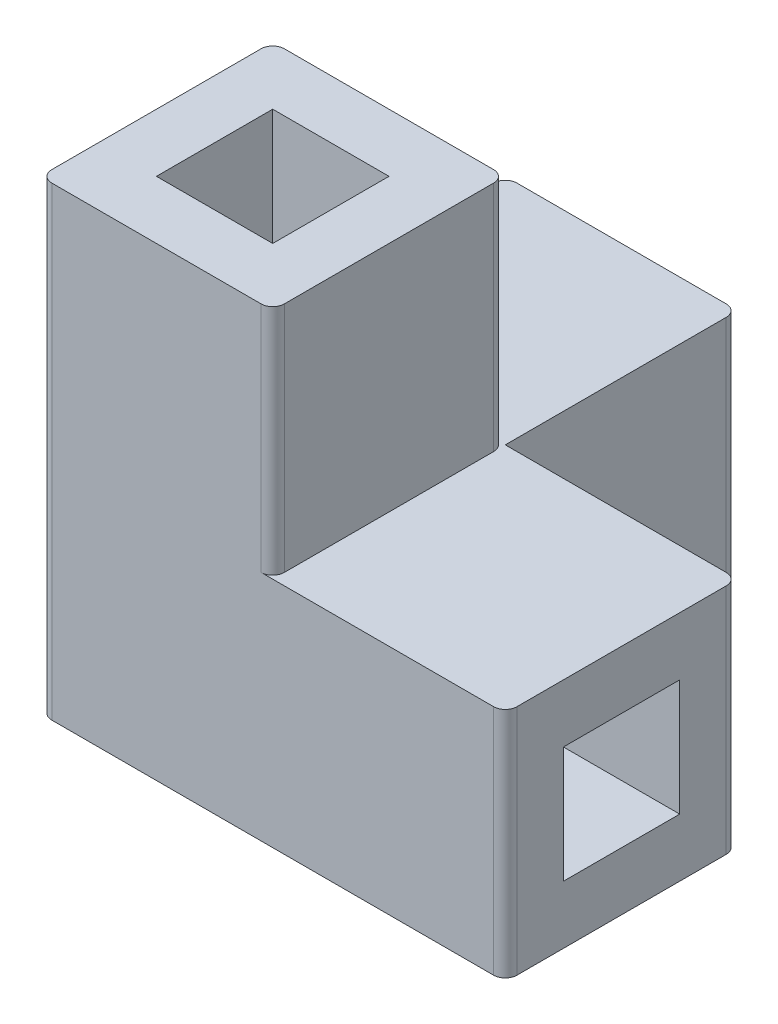
from build123d import *

# Parameters (mm, degrees)
SALIENTE_EXTRUIR1_DEPTH = 80
CROQUIS2_W              = 40
CROQUIS2_H              = 40
CORTAR_EXTRUIR1_DEPTH   = 80
CROQUIS3_W              = 40
CROQUIS3_H              = 40
CORTAR_EXTRUIR2_DEPTH   = 80
REDONDEO1_R             = 2
CROQUIS4_W              = 20
CROQUIS4_H              = 20
CORTAR_EXTRUIR3_DEPTH   = 80
CROQUIS5_W              = 20
CROQUIS5_H              = 20
CORTAR_EXTRUIR4_DEPTH   = 50
CROQUIS6_W              = 20
CROQUIS6_H              = 20
CORTAR_EXTRUIR5_DEPTH   = 50


with BuildPart() as part:
    # Croquis1 → Saliente-Extruir1 (new body)
    with BuildSketch(Plane(origin=(0, 0, 0), x_dir=(1, 0, 0), z_dir=(0, 1, 0))):
        Polygon((0, 80), (0, 0), (80, 0), (80, 40), (40, 40), (40, 80), align=None)
    extrude(amount=SALIENTE_EXTRUIR1_DEPTH)

    # Croquis2 → Cortar-Extruir1 (cut)
    with BuildSketch(Plane.XY):
        with Locations((60, 60)):
            Rectangle(CROQUIS2_W, CROQUIS2_H)
    extrude(amount=-CORTAR_EXTRUIR1_DEPTH, mode=Mode.SUBTRACT)

    # Croquis3 → Cortar-Extruir2 (cut)
    with BuildSketch(Plane(origin=(40, 0, 0), x_dir=(0, 0, -1), z_dir=(1, 0, 0))):
        with Locations((60, 60)):
            Rectangle(CROQUIS3_W, CROQUIS3_H)
    extrude(amount=-CORTAR_EXTRUIR2_DEPTH, mode=Mode.SUBTRACT)

    # Redondeo1
    # the kernel refuses this fillet: 2 mm, written as the material it takes off along each edge
    with BuildSketch(Plane(origin=(0, -5, 0), x_dir=(0, 0, -1), z_dir=(0, 1, 0))) as redondeo1_piece_1:
        with BuildLine():
            CenterArc((REDONDEO1_R, -REDONDEO1_R), REDONDEO1_R, 90, 90)
            Line((0, -REDONDEO1_R), (0, 0))
            Line((0, 0), (REDONDEO1_R, 0))
        make_face()
    extrude(amount=90, mode=Mode.SUBTRACT)
    with BuildSketch(Plane(origin=(80, -5, -40), x_dir=(0, 0, 1), z_dir=(0, 1, 0)), Plane(origin=(80, -5, 0), x_dir=(-1, 0, 0), z_dir=(0, 1, 0)), Plane(origin=(40, 45, -80), x_dir=(-1, 0, 0), z_dir=(0, -1, 0))) as redondeo1_piece_2:
        with BuildLine():
            CenterArc((REDONDEO1_R, -REDONDEO1_R), REDONDEO1_R, 90, 90)
            Line((0, -REDONDEO1_R), (0, 0))
            Line((0, 0), (REDONDEO1_R, 0))
        make_face()
    extrude(amount=50, mode=Mode.SUBTRACT)
    with BuildSketch(Plane(origin=(40, 85, 0), x_dir=(-1, 0, 0), z_dir=(0, -1, 0))) as redondeo1_piece_3:
        with BuildLine():
            CenterArc((REDONDEO1_R, REDONDEO1_R), REDONDEO1_R, 180, 90)
            Line((0, REDONDEO1_R), (0, 0))
            Line((0, 0), (REDONDEO1_R, 0))
        make_face()
    extrude(amount=45, mode=Mode.SUBTRACT)
    with BuildSketch(Plane(origin=(0, -5, -80), x_dir=(0, 0, 1), z_dir=(0, 1, 0))) as redondeo1_piece_4:
        with BuildLine():
            CenterArc((REDONDEO1_R, REDONDEO1_R), REDONDEO1_R, 180, 90)
            Line((0, REDONDEO1_R), (0, 0))
            Line((0, 0), (REDONDEO1_R, 0))
        make_face()
    extrude(amount=50, mode=Mode.SUBTRACT)
    with BuildSketch(Plane(origin=(0, 85, -40), x_dir=(0, 0, 1), z_dir=(0, -1, 0)), Plane(origin=(40, 85, -40), x_dir=(-1, 0, 0), z_dir=(0, -1, 0))) as redondeo1_piece_5:
        with BuildLine():
            CenterArc((REDONDEO1_R, -REDONDEO1_R), REDONDEO1_R, 90, 90)
            Line((0, -REDONDEO1_R), (0, 0))
            Line((0, 0), (REDONDEO1_R, 0))
        make_face()
    extrude(amount=45, mode=Mode.SUBTRACT)

    # Croquis4 → Cortar-Extruir3 (cut)
    with BuildSketch(Plane(origin=(0, 80, 0), x_dir=(1, 0, 0), z_dir=(0, 1, 0))):
        with Locations((20, 20)):
            Rectangle(CROQUIS4_W, CROQUIS4_H)
    extrude(amount=-CORTAR_EXTRUIR3_DEPTH, mode=Mode.SUBTRACT)

    # Croquis5 → Cortar-Extruir4 (cut)
    with BuildSketch(Plane(origin=(0, 0, -80), x_dir=(-1, 0, 0), z_dir=(0, 0, -1))):
        with Locations((-20, 20)):
            Rectangle(CROQUIS5_W, CROQUIS5_H)
    extrude(amount=-CORTAR_EXTRUIR4_DEPTH, mode=Mode.SUBTRACT)

    # Croquis6 → Cortar-Extruir5 (cut)
    with BuildSketch(Plane(origin=(80, 0, 0), x_dir=(0, 0, -1), z_dir=(1, 0, 0))):
        with Locations((20, 20)):
            Rectangle(CROQUIS6_W, CROQUIS6_H)
    extrude(amount=-CORTAR_EXTRUIR5_DEPTH, mode=Mode.SUBTRACT)


solid = part.part
